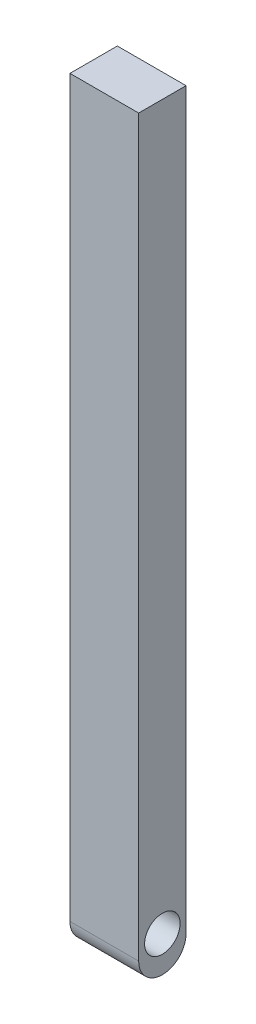
from build123d import *

# Parameters (mm, degrees)
ESQUISSE1_W             = 2.9
ESQUISSE1_H             = 32
BOSS_EXTRU_1_DEPTH      = 2
CONG_1_R                = 1
ESQUISSE2_R             = 0.75
ENL_V_MAT_EXTRU_1_DEPTH = 3


with BuildPart() as part:
    # Esquisse1 → Boss.-Extru.1 (new body)
    with BuildSketch(Plane.XY):
        with Locations((-0.688215542, -5.823189522)):
            Rectangle(ESQUISSE1_W, ESQUISSE1_H)
    extrude(amount=BOSS_EXTRU_1_DEPTH)

    # Congé1
    cong_1_edges = [part.edges().sort_by_distance(p)[0] for p in [
        (-0.688215542, -21.823189522, 2),
        (-0.688215542, -21.823189522, 0),
    ]]
    fillet(cong_1_edges, radius=CONG_1_R - 0.0001)  # a hair under: the kernel refuses the full size

    # Esquisse2 → Enlèv. mat.-Extru.1 (cut)
    with BuildSketch(Plane(origin=(0.761784458, 0, 0), x_dir=(0, 0, -1), z_dir=(1, 0, 0))):
        with Locations(Location((-1, -20.323189522, 0), (0, 0, 90))):
            Circle(ESQUISSE2_R)
    extrude(amount=-ENL_V_MAT_EXTRU_1_DEPTH, mode=Mode.SUBTRACT)


solid = part.part
